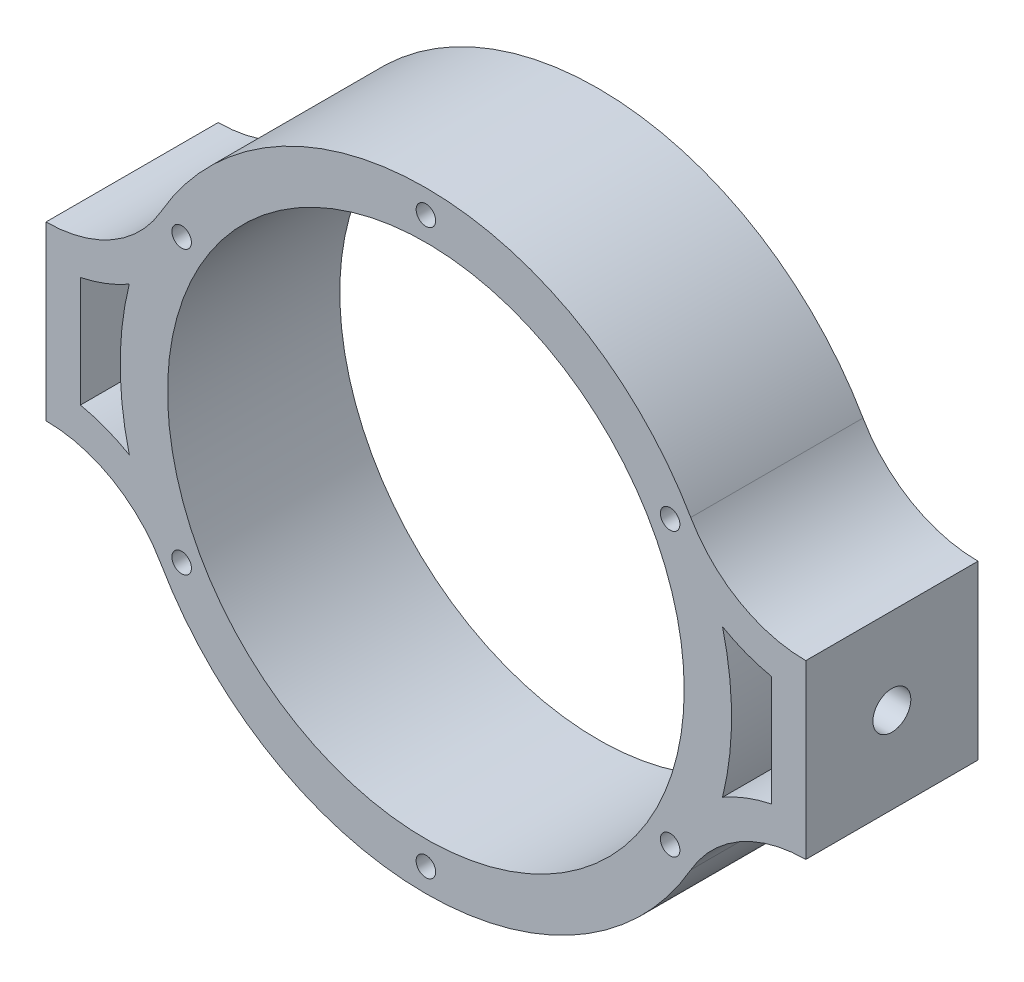
from build123d import *

# Parameters (mm, degrees)
SKETCH1_R                = 45
BOSS_EXTRUDE1_DEPTH      = 15
CUT_EXTRUDE1_DEPTH       = 91.081591488
CUT_EXTRUDE1_DEPTH_BACK  = 91.081591488
M6_CLEARANCE_HOLE1_D     = 6.6
M6_CLEARANCE_HOLE1_DEPTH = 6
M6_CLEARANCE_HOLE1_TIP   = 1.982840043
M6_CLEARANCE_HOLE2_D     = 6.6
M6_CLEARANCE_HOLE2_DEPTH = 6
M6_CLEARANCE_HOLE2_TIP   = 1.982840043
M3_CLEARANCE_HOLE1_D     = 3.4
CIRPATTERN1_COUNT        = 6


with BuildPart() as part:
    # Sketch1 → Boss-Extrude1 (new, symmetric)
    with BuildSketch(Plane.XY):
        with BuildLine():
            Line((-66.175, -15), (-66.175, 15))
            ThreePointArc((-66.175, 15), (-54.605786302, 18.103041727), (-46.142284003, 26.579167161))
            ThreePointArc((-46.142284003, 26.579167161), (0, 53.25), (46.142284003, 26.579167161))
            ThreePointArc((46.142284003, 26.579167161), (54.605786302, 18.103041727), (66.175, 15))
            Line((66.175, 15), (66.175, -15))
            ThreePointArc((66.175, -15), (54.605786302, -18.103041727), (46.142284003, -26.579167161))
            ThreePointArc((46.142284003, -26.579167161), (0, -53.25), (-46.142284003, -26.579167161))
            ThreePointArc((-46.142284003, -26.579167161), (-54.605786302, -18.103041727), (-66.175, -15))
        make_face()
        Circle(SKETCH1_R, mode=Mode.SUBTRACT)
    extrude(amount=BOSS_EXTRUDE1_DEPTH, both=True)

    # Sketch2 → Cut-Extrude1 (cut, two sides: drawn at the far end of the back side and taken through both)
    with BuildSketch(Plane.XY.offset(15).offset(-CUT_EXTRUDE1_DEPTH_BACK)):
        with BuildLine():
            Line((-60.175, -9.624867567), (-60.175, 9.624867567))
            ThreePointArc((-60.175, 9.624867567), (-55.795757401, 10.912645684), (-51.671575635, 12.868984861))
            ThreePointArc((-51.671575635, 12.868984861), (-53.25, 0), (-51.671575635, -12.868984861))
            ThreePointArc((-51.671575635, -12.868984861), (-55.795757401, -10.912645684), (-60.175, -9.624867567))
        make_face()
        with BuildLine():
            Line((60.175, -9.624867567), (60.175, 9.624867567))
            ThreePointArc((60.175, 9.624867567), (55.795757401, 10.912645684), (51.671575635, 12.868984861))
            ThreePointArc((51.671575635, 12.868984861), (53.25, 0), (51.671575635, -12.868984861))
            ThreePointArc((51.671575635, -12.868984861), (55.795757401, -10.912645684), (60.175, -9.624867567))
        make_face()
    extrude(amount=CUT_EXTRUDE1_DEPTH + CUT_EXTRUDE1_DEPTH_BACK, mode=Mode.SUBTRACT)

    # M6 Clearance Hole1
    with Locations(Plane.ZY.offset(66.175)):
        with Locations((0, 0)):
            Hole(M6_CLEARANCE_HOLE1_D / 2, depth=M6_CLEARANCE_HOLE1_DEPTH)
            with Locations((0, 0, -(M6_CLEARANCE_HOLE1_DEPTH + M6_CLEARANCE_HOLE1_TIP / 2))):  # 118° drill point
                Cone(0, M6_CLEARANCE_HOLE1_D / 2, M6_CLEARANCE_HOLE1_TIP, mode=Mode.SUBTRACT)

    # M6 Clearance Hole2
    with Locations(Plane(origin=(66.175, 0, 0), x_dir=(0, 0, -1), z_dir=(1, 0, 0))):
        with Locations((0, 0)):
            Hole(M6_CLEARANCE_HOLE2_D / 2, depth=M6_CLEARANCE_HOLE2_DEPTH)
            with Locations((0, 0, -(M6_CLEARANCE_HOLE2_DEPTH + M6_CLEARANCE_HOLE2_TIP / 2))):  # 118° drill point
                Cone(0, M6_CLEARANCE_HOLE2_D / 2, M6_CLEARANCE_HOLE2_TIP, mode=Mode.SUBTRACT)

    # M3 Clearance Hole1 (through all)
    with Locations(Plane.XY.offset(15)):
        with Locations((0, 49.125)):
            m3_clearance_hole1 = Hole(M3_CLEARANCE_HOLE1_D / 2)

    # CirPattern1: M3 Clearance Hole1 ×6 about axis
    cirpattern1_axis = Axis((0, 0, 15), (0, 0, -1))
    for i in range(1, CIRPATTERN1_COUNT):
        add(m3_clearance_hole1.rotate(cirpattern1_axis, i * 360 / CIRPATTERN1_COUNT), mode=Mode.SUBTRACT)


solid = part.part
